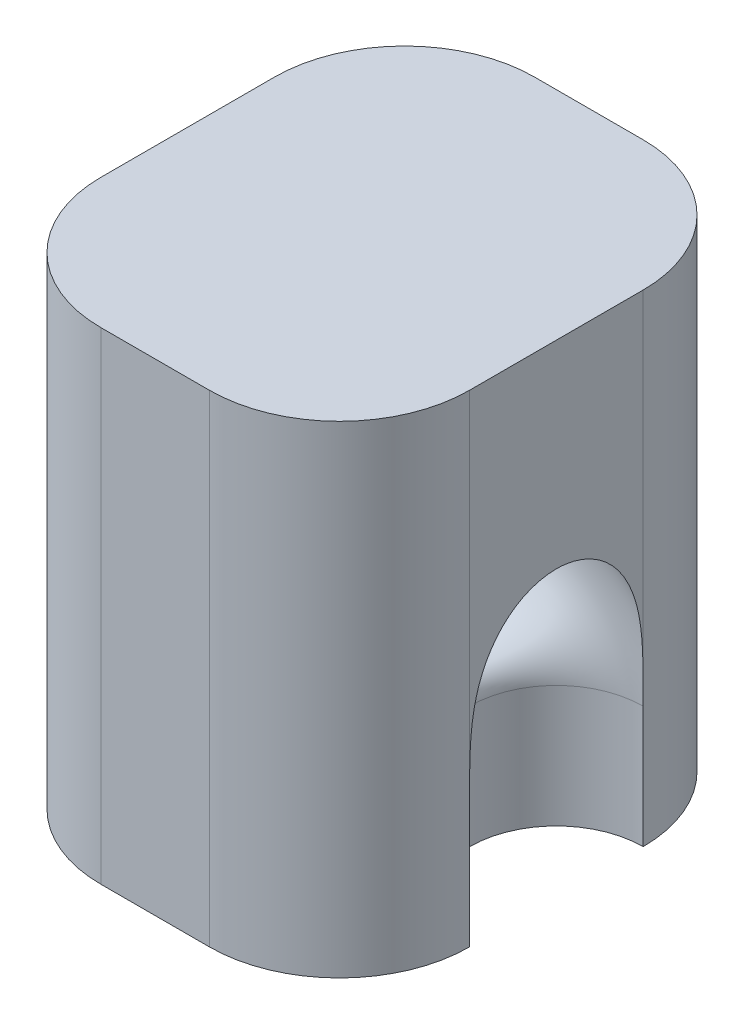
from build123d import *

# Parameters (mm, degrees)
BOSS_EXTRUDE1_DEPTH     = 10
CUT_EXTRUDE2_DEPTH      = 50.456381745
CUT_EXTRUDE2_DEPTH_BACK = 50.456381745
SKETCH3_R               = 2.5
CUT_EXTRUDE3_DEPTH      = 6
SKETCH4_R               = 2
CUT_REVOLVE1_ANGLE      = 90
SKETCH5_R               = 2
CUT_EXTRUDE4_DEPTH      = 2.805452299
FILLET1_R               = 5
SKETCH6_W               = 10
SKETCH6_H               = 29.685485307
CUT_EXTRUDE5_DEPTH      = 33
SKETCH7_W               = 19.76767366
SKETCH7_H               = 10
CUT_EXTRUDE6_DEPTH      = 48.418220859
SKETCH8_W               = 3.5
SKETCH8_H               = 11.210857043
CUT_EXTRUDE7_DEPTH      = 48.41822072
FILLET2_R               = 3


with BuildPart() as part:
    # Sketch1 → Boss-Extrude1 (new body)
    with BuildSketch(Plane.XY):
        with BuildLine():
            Line((0, 0), (45, 0))
            Line((45, 0), (45, 11.1125))
            Line((45, 11.1125), (35, 11.1125))
            add(Edge.make_bspline(
                [(10, 11.1125), (14.576625097, 20.181995974), (30.423374903, 20.181995974), (35, 11.1125)],
                knots=[0, 0, 0, 0, 1, 1, 1, 1], degree=3))
            Line((10, 11.1125), (0, 11.1125))
            Line((0, 11.1125), (0, 0))
        make_face()
    extrude(amount=-BOSS_EXTRUDE1_DEPTH)

    # Sketch2 → Cut-Extrude2 (cut, two sides: drawn at the far end of the back side and taken through both)
    with BuildSketch(Plane.XY.offset(-CUT_EXTRUDE2_DEPTH_BACK)):
        with BuildLine():
            Line((33, 0), (33, 10.610904597))
            add(Edge.make_bspline(
                [(33, 10.610904597), (32.518518069, 11.455367364), (31.27134268, 12.982349636), (27.931157473, 15.20113612), (22.5, 16.390279221), (17.068842527, 15.20113612), (13.72865732, 12.982349636), (12.481481931, 11.455367364), (12, 10.610904597)],
                knots=[0.018308459, 0.018308459, 0.018308459, 0.018308459, 0.138731344, 0.25915423, 0.5, 0.74084577, 0.861268656, 0.981691541, 0.981691541, 0.981691541, 0.981691541], degree=3))
            Line((12, 10.610904597), (12, 0))
            Line((12, 0), (33, 0))
        make_face()
    extrude(amount=CUT_EXTRUDE2_DEPTH + CUT_EXTRUDE2_DEPTH_BACK, mode=Mode.SUBTRACT)

    # Sketch3 → Cut-Extrude3 (cut)
    with BuildSketch(Plane(origin=(12, 0, 0), x_dir=(0, 0, -1), z_dir=(1, 0, 0))):
        with Locations(Location((5, 5.305452299, 0), (0, 0, 90))):
            Circle(SKETCH3_R)
    cut_extrude3 = extrude(amount=-CUT_EXTRUDE3_DEPTH, mode=Mode.SUBTRACT)

    # Sketch4 → Cut-Revolve1 (revolve, cut)
    with BuildSketch(Plane(origin=(6, 0, 0), x_dir=(0, 0, -1), z_dir=(1, 0, 0))):
        with Locations((5, 5.305452299)):
            Circle(SKETCH4_R)
    cut_revolve1 = revolve(axis=Axis((6, 2.805452299, -5), (0, 0, 1)), revolution_arc=CUT_REVOLVE1_ANGLE, mode=Mode.SUBTRACT)

    # Sketch5 → Cut-Extrude4 (cut)
    with BuildSketch(Plane(origin=(0, 2.805452299, 0), x_dir=(1, 0, 0), z_dir=(0, 1, 0))):
        with Locations(Location((3.5, 5, 0), (0, 0, 180))):
            Circle(SKETCH5_R)
    cut_extrude4 = extrude(amount=-CUT_EXTRUDE4_DEPTH, mode=Mode.SUBTRACT)

    # Mirror1: Cut-Extrude3, Cut-Revolve1, Cut-Extrude4 across plane
    add(cut_extrude3.mirror(Plane(origin=(22.5, 0, 0), x_dir=(0, 0, 1), z_dir=(1, 0, 0))), mode=Mode.SUBTRACT)
    add(cut_revolve1.mirror(Plane(origin=(22.5, 0, 0), x_dir=(0, 0, 1), z_dir=(1, 0, 0))), mode=Mode.SUBTRACT)
    add(cut_extrude4.mirror(Plane(origin=(22.5, 0, 0), x_dir=(0, 0, 1), z_dir=(1, 0, 0))), mode=Mode.SUBTRACT)

    # Fillet1
    fillet1_edges = [part.edges().sort_by_distance(p)[0] for p in [
        (10, 11.1125, -5),
        (35, 11.1125, -5),
        (33, 10.610904597, -5),
        (12, 10.610904597, -5),
    ]]
    fillet(fillet1_edges, radius=FILLET1_R)

    # Sketch6 → Cut-Extrude5 (cut)
    with BuildSketch(Plane.ZY):
        with Locations((-5, 14.842742654)):
            Rectangle(SKETCH6_W, SKETCH6_H)
    extrude(amount=-CUT_EXTRUDE5_DEPTH, mode=Mode.SUBTRACT)

    # Sketch7 → Cut-Extrude6 (cut, through all)
    with BuildSketch(Plane(origin=(0, 11.1125, 0), x_dir=(1, 0, 0), z_dir=(0, 1, 0))):
        with Locations((35.11616317, 5)):
            Rectangle(SKETCH7_W, SKETCH7_H)
    extrude(amount=CUT_EXTRUDE6_DEPTH, mode=Mode.SUBTRACT)

    # Sketch8 → Cut-Extrude7 (cut, through all)
    with BuildSketch(Plane.XZ):
        with Locations((43.25, -4.394571478)):
            Rectangle(SKETCH8_W, SKETCH8_H)
    extrude(amount=-CUT_EXTRUDE7_DEPTH, mode=Mode.SUBTRACT)

    # Fillet2
    # the kernel refuses this fillet: 3 mm, written as the material it takes off along each edge
    with BuildSketch(Plane(origin=(33, 18.6125, -10), x_dir=(0, 0, 1), z_dir=(0, -1, 0)), Plane(origin=(33, 18.6125, 0), x_dir=(1, 0, 0), z_dir=(0, -1, 0)), Plane(origin=(41.5, -7.5, -10), x_dir=(0, 0, 1), z_dir=(0, 1, 0))) as fillet2_piece_1:
        with BuildLine():
            CenterArc((FILLET2_R, -FILLET2_R), FILLET2_R, 90, 90)
            Line((0, -FILLET2_R), (0, 0))
            Line((0, 0), (FILLET2_R, 0))
        make_face()
    extrude(amount=26.1125, mode=Mode.SUBTRACT)
    with BuildSketch(Plane(origin=(41.5, 18.6125, 0), x_dir=(-1, 0, 0), z_dir=(0, -1, 0))) as fillet2_piece_2:
        with BuildLine():
            CenterArc((FILLET2_R, FILLET2_R), FILLET2_R, 180, 90)
            Line((0, FILLET2_R), (0, 0))
            Line((0, 0), (FILLET2_R, 0))
        make_face()
    extrude(amount=26.1125, mode=Mode.SUBTRACT)


solid = part.part
